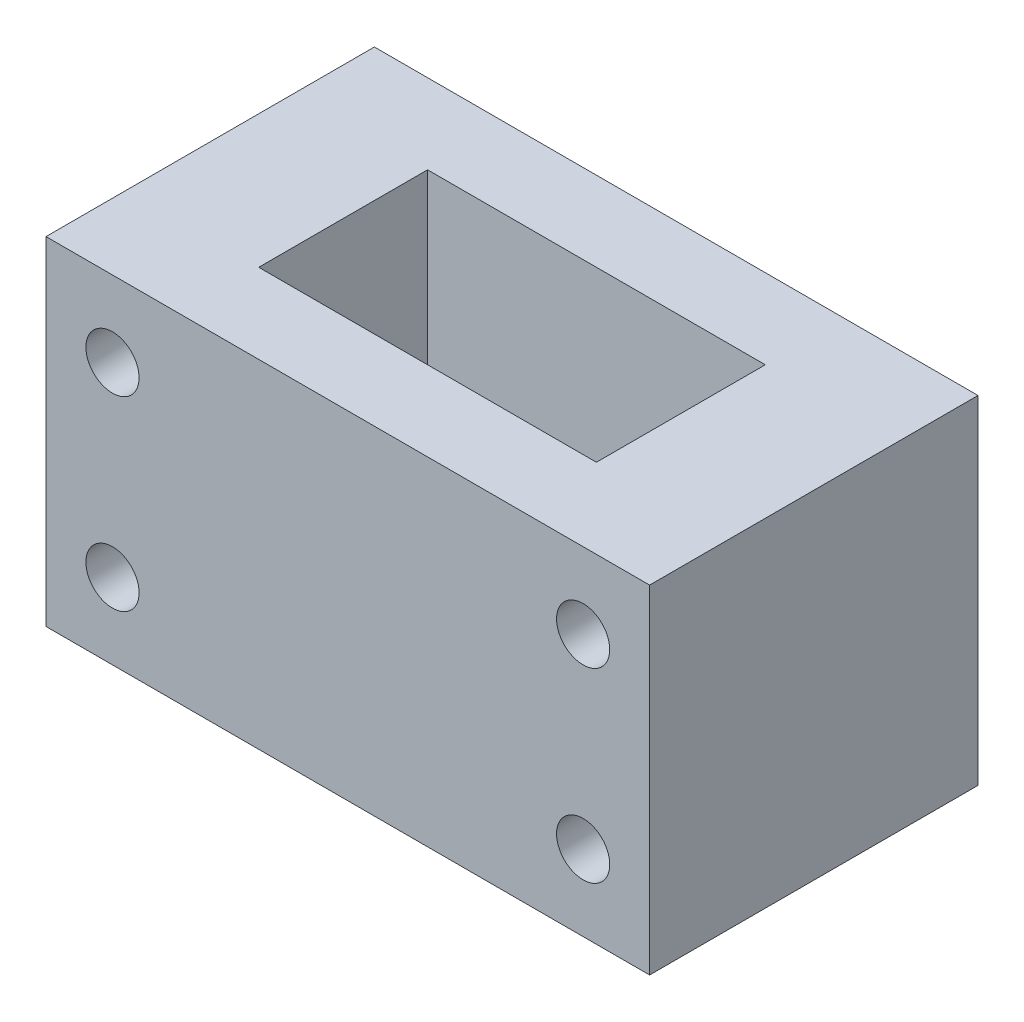
from build123d import *

# Parameters (mm, degrees)
SKETCH1_W           = 45.4
SKETCH1_H           = 24.7
SKETCH1_W_2         = 25.4
SKETCH1_H_2         = 12.7
BOSS_EXTRUDE1_DEPTH = 25.4
SKETCH2_R           = 2
CUT_EXTRUDE1_DEPTH  = 43.077785113


with BuildPart() as part:
    # Sketch1 → Boss-Extrude1 (new body)
    with BuildSketch(Plane(origin=(0, 0, 0), x_dir=(1, 0, 0), z_dir=(0, 1, 0))):
        Rectangle(SKETCH1_W, SKETCH1_H)
        Rectangle(SKETCH1_W_2, SKETCH1_H_2, mode=Mode.SUBTRACT)
    extrude(amount=BOSS_EXTRUDE1_DEPTH)

    # Sketch2 → Cut-Extrude1 (cut, through all)
    with BuildSketch(Plane(origin=(0, 0, -12.35), x_dir=(-1, 0, 0), z_dir=(0, 0, -1))):
        with Locations((-17.7, 5.7)):
            Circle(SKETCH2_R)
        with Locations((-17.7, 19.7)):
            Circle(SKETCH2_R)
        with Locations((17.7, 19.7)):
            Circle(SKETCH2_R)
        with Locations((17.7, 5.7)):
            Circle(SKETCH2_R)
    extrude(amount=-CUT_EXTRUDE1_DEPTH, mode=Mode.SUBTRACT)


solid = part.part
